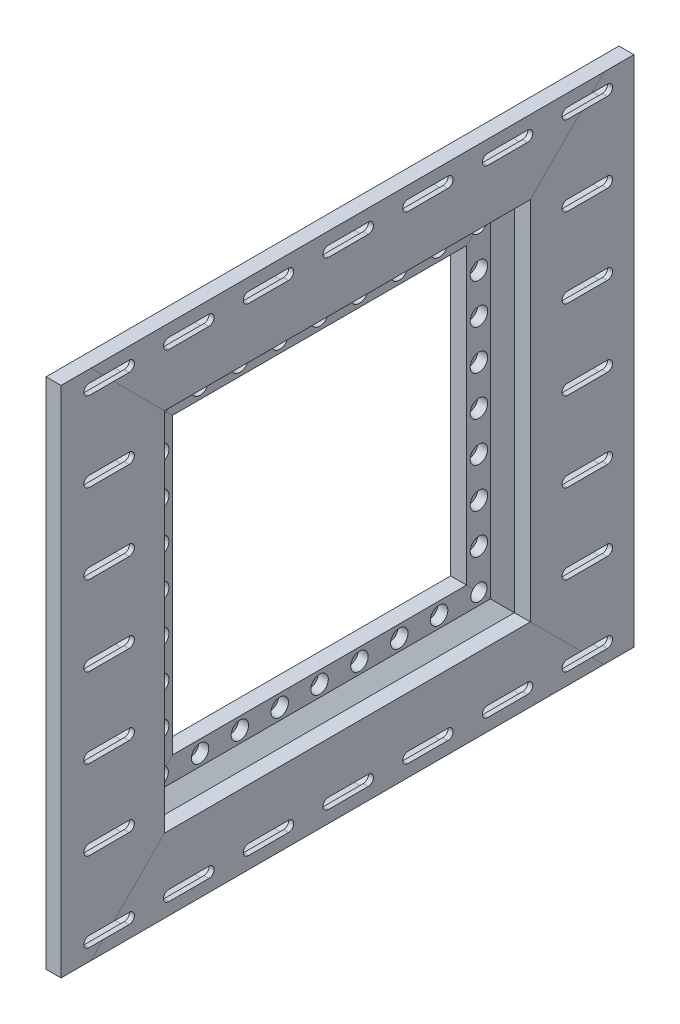
from build123d import *

# Parameters (mm, degrees)
FREE_START                                           = -9.2645
WALL_SCREW_HOLES_R                                   = 3.3782
WALL_SCREW_HOLES_R_2                                 = 5.1945
FREE_FIT_THROUGH_HOLES_DEPTH                         = 10.5345
WALL_SCREWS_CBORE_FOR_1_4_SOCKET_HEAD_CA_D           = 6.7564
WALL_SCREWS_CBORE_FOR_1_4_SOCKET_HEAD_CA_CBORE_D     = 11.1125
WALL_SCREWS_CBORE_FOR_1_4_SOCKET_HEAD_CA_CBORE_DEPTH = 6.35
BOSS_EXTRUDE1_START                                  = 9.525
SKETCH21_W                                           = 19.05
SKETCH21_H                                           = 327.15
BOSS_EXTRUDE1_DEPTH                                  = 9.525
CBORE_START                                          = 9.525
CBORE_SLOT_FOR_1_4_SOCKET_HEAD_CAP_SCREW_DEPTH       = 6.35
CBORE_START_2                                        = 15.875
CBORE_SLOT_FOR_1_4_SOCKET_HEAD_CAP_S_3_DEPTH         = 3.175


# Read off the part's stored shape, not the designer's step: CBORE SLOT for 1/4 Socket Head Cap Screw1
with BuildPart() as part:
    # Frame: sweep along a path in Boundary
    with BuildLine(Plane.ZY) as frame_path:
        Line((0, 0), (-263.65, 0))
        Line((-263.65, 0), (-263.65, 263.65))
        Line((-263.65, 263.65), (0, 263.65))
        Line((0, 263.65), (0, 0))
    # Leg Sketch → Frame (sweep)
    with BuildSketch(Plane.XY):
        Polygon((19.05, 15.24), (8.89, 15.24), (1.27, 22.86), (1.27, 38.1), (-8.89, 38.1), (-8.89, 25.4), (-15.24, 19.05), (-15.24, 15.24), (0, 0), (9.525, 0), (9.525, -31.75), (19.05, -31.75), align=None)
    sweep(path=frame_path.line, transition=Transition.RIGHT)

    # Wall Screw Holes → Free Fit Through Holes (cut)
    with BuildSketch(Plane(origin=(0, 0, 0), x_dir=(0, 0, -1), z_dir=(1, 0, 0)).offset(FREE_START)):
        with Locations(Location((30.23, 55.63, 0), (0, 0, 180))):
            Circle(WALL_SCREW_HOLES_R)
        with Locations(Location((55.63, 30.23, 0), (0, 0, 180))):
            Circle(WALL_SCREW_HOLES_R)
        with Locations(Location((30.23, 81.03, 0), (0, 0, 180))):
            Circle(WALL_SCREW_HOLES_R)
        with Locations(Location((30.23, 106.43, 0), (0, 0, 180))):
            Circle(WALL_SCREW_HOLES_R)
        with Locations(Location((30.23, 131.83, 0), (0, 0, 180))):
            Circle(WALL_SCREW_HOLES_R)
        with Locations(Location((30.23, 157.23, 0), (0, 0, 180))):
            Circle(WALL_SCREW_HOLES_R)
        with Locations(Location((30.23, 182.63, 0), (0, 0, 180))):
            Circle(WALL_SCREW_HOLES_R)
        with Locations(Location((30.23, 208.03, 0), (0, 0, 180))):
            Circle(WALL_SCREW_HOLES_R)
        with Locations(Location((55.63, 233.42, 0), (0, 0, 180))):
            Circle(WALL_SCREW_HOLES_R)
        with Locations(Location((81.03, 233.42, 0), (0, 0, 180))):
            Circle(WALL_SCREW_HOLES_R)
        with Locations(Location((81.03, 30.23, 0), (0, 0, 180))):
            Circle(WALL_SCREW_HOLES_R)
        with Locations(Location((106.43, 233.42, 0), (0, 0, 180))):
            Circle(WALL_SCREW_HOLES_R)
        with Locations(Location((106.43, 30.23, 0), (0, 0, 180))):
            Circle(WALL_SCREW_HOLES_R)
        with Locations(Location((131.83, 233.42, 0), (0, 0, 180))):
            Circle(WALL_SCREW_HOLES_R)
        with Locations(Location((131.83, 30.23, 0), (0, 0, 180))):
            Circle(WALL_SCREW_HOLES_R)
        with Locations(Location((157.23, 233.42, 0), (0, 0, 180))):
            Circle(WALL_SCREW_HOLES_R)
        with Locations(Location((157.23, 30.23, 0), (0, 0, 180))):
            Circle(WALL_SCREW_HOLES_R)
        with Locations(Location((182.63, 233.42, 0), (0, 0, 180))):
            Circle(WALL_SCREW_HOLES_R)
        with Locations(Location((182.63, 30.23, 0), (0, 0, 180))):
            Circle(WALL_SCREW_HOLES_R)
        with Locations(Location((208.03, 233.42, 0), (0, 0, 180))):
            Circle(WALL_SCREW_HOLES_R)
        with Locations(Location((208.03, 30.23, 0), (0, 0, 180))):
            Circle(WALL_SCREW_HOLES_R)
        with Locations(Location((233.42, 81.03, 0), (0, 0, 180))):
            Circle(WALL_SCREW_HOLES_R)
        with Locations(Location((233.42, 55.63, 0), (0, 0, 180))):
            Circle(WALL_SCREW_HOLES_R)
        with Locations(Location((233.42, 106.43, 0), (0, 0, 180))):
            Circle(WALL_SCREW_HOLES_R)
        with Locations(Location((233.42, 131.83, 0), (0, 0, 180))):
            Circle(WALL_SCREW_HOLES_R)
        with Locations(Location((233.42, 157.23, 0), (0, 0, 180))):
            Circle(WALL_SCREW_HOLES_R)
        with Locations(Location((233.42, 182.63, 0), (0, 0, 180))):
            Circle(WALL_SCREW_HOLES_R)
        with Locations(Location((233.42, 208.03, 0), (0, 0, 180))):
            Circle(WALL_SCREW_HOLES_R)
        with Locations(Location((30.23, 233.43, 0), (0, 0, 135.077994507))):
            Circle(WALL_SCREW_HOLES_R_2)
        with Locations(Location((233.42, 233.43, 0), (0, 0, 225.077994507))):
            Circle(WALL_SCREW_HOLES_R_2)
        with Locations(Location((233.42, 30.23, 0), (0, 0, 135))):
            Circle(WALL_SCREW_HOLES_R_2)
        with Locations(Location((30.23, 30.23, 0), (0, 0, 225))):
            Circle(WALL_SCREW_HOLES_R_2)
    extrude(amount=FREE_FIT_THROUGH_HOLES_DEPTH, mode=Mode.SUBTRACT)

    # Wall Screws CBORE for 1/4 Socket Head Cap Screw1 (through all)
    with Locations(Plane(origin=(1.27, 208.03, -30.23), x_dir=(0, 0, 1), z_dir=(1, 0, 0))):
        with Locations((0, 0), (0, 25.4), (0, 50.8), (0, 76.2), (0, 101.6), (0, 127), (0, 152.4), (-25.4, 177.8), (-50.8, 177.8), (-177.8, 177.8), (-152.4, 177.8), (-127, 177.8), (-101.6, 177.8), (-76.2, 177.8), (-203.19, 152.4), (-203.19, 127), (-203.19, 76.2), (-203.19, 50.8), (-203.19, 25.4), (-203.19, 0), (-177.8, -25.39), (-152.4, -25.39), (-127, -25.39), (-101.6, -25.39), (-76.2, -25.39), (-50.8, -25.39), (-25.4, -25.39), (-203.19, 101.6)):
            CounterBoreHole(WALL_SCREWS_CBORE_FOR_1_4_SOCKET_HEAD_CA_D / 2, WALL_SCREWS_CBORE_FOR_1_4_SOCKET_HEAD_CA_CBORE_D / 2, WALL_SCREWS_CBORE_FOR_1_4_SOCKET_HEAD_CA_CBORE_DEPTH)

    # Sketch21 → Boss-Extrude1 (add)
    with BuildSketch(Plane(origin=(0, 0, 0), x_dir=(0, 0, -1), z_dir=(1, 0, 0)).offset(BOSS_EXTRUDE1_START)):
        with Locations((304.925, 131.825)):
            Rectangle(SKETCH21_W, SKETCH21_H)
        with Locations((-41.275, 131.825)):
            Rectangle(SKETCH21_W, SKETCH21_H)
    extrude(amount=BOSS_EXTRUDE1_DEPTH)

    # CBORE SLOT for 1_4 Socket Head Cap S 2 → CBORE SLOT for 1/4 Socket Head Cap Screw1 (cut)
    with BuildSketch(Plane.YZ.offset(CBORE_START)):
        with BuildLine():
            ThreePointArc((238.98125, 32.8), (233.425, 38.35625), (227.86875, 32.8))
            Line((227.86875, 32.8), (227.86875, 7.4))
            ThreePointArc((227.86875, 7.4), (233.425, 1.84375), (238.98125, 7.4))
            Line((238.98125, 7.4), (238.98125, 32.8))
        make_face()
        with BuildLine():
            Line((238.98125, -297.4), (238.98125, -272))
            ThreePointArc((238.98125, -272), (233.425, -266.44375), (227.86875, -272))
            Line((227.86875, -272), (227.86875, -297.4))
            ThreePointArc((227.86875, -297.4), (233.425, -302.95625), (238.98125, -297.4))
        make_face()
        with BuildLine():
            ThreePointArc((188.18125, 32.8), (182.625, 38.35625), (177.06875, 32.8))
            Line((177.06875, 32.8), (177.06875, 7.4))
            ThreePointArc((177.06875, 7.4), (182.625, 1.84375), (188.18125, 7.4))
            Line((188.18125, 7.4), (188.18125, 32.8))
        make_face()
        with BuildLine():
            Line((188.18125, -297.4), (188.18125, -272))
            ThreePointArc((188.18125, -272), (182.625, -266.44375), (177.06875, -272))
            Line((177.06875, -272), (177.06875, -297.4))
            ThreePointArc((177.06875, -297.4), (182.625, -302.95625), (188.18125, -297.4))
        make_face()
        with BuildLine():
            ThreePointArc((137.38125, 32.8), (131.825, 38.35625), (126.26875, 32.8))
            Line((126.26875, 32.8), (126.26875, 7.4))
            ThreePointArc((126.26875, 7.4), (131.825, 1.84375), (137.38125, 7.4))
            Line((137.38125, 7.4), (137.38125, 32.8))
        make_face()
        with BuildLine():
            Line((137.38125, -297.4), (137.38125, -272))
            ThreePointArc((137.38125, -272), (131.825, -266.44375), (126.26875, -272))
            Line((126.26875, -272), (126.26875, -297.4))
            ThreePointArc((126.26875, -297.4), (131.825, -302.95625), (137.38125, -297.4))
        make_face()
        with BuildLine():
            ThreePointArc((86.58125, 32.8), (81.025, 38.35625), (75.46875, 32.8))
            Line((75.46875, 32.8), (75.46875, 7.4))
            ThreePointArc((75.46875, 7.4), (81.025, 1.84375), (86.58125, 7.4))
            Line((86.58125, 7.4), (86.58125, 32.8))
        make_face()
        with BuildLine():
            Line((86.58125, -297.4), (86.58125, -272))
            ThreePointArc((86.58125, -272), (81.025, -266.44375), (75.46875, -272))
            Line((75.46875, -272), (75.46875, -297.4))
            ThreePointArc((75.46875, -297.4), (81.025, -302.95625), (86.58125, -297.4))
        make_face()
        with BuildLine():
            ThreePointArc((35.78125, 32.8), (30.225, 38.35625), (24.66875, 32.8))
            Line((24.66875, 32.8), (24.66875, 7.4))
            ThreePointArc((24.66875, 7.4), (30.225, 1.84375), (35.78125, 7.4))
            Line((35.78125, 7.4), (35.78125, 32.8))
        make_face()
        with BuildLine():
            Line((35.78125, -297.4), (35.78125, -272))
            ThreePointArc((35.78125, -272), (30.225, -266.44375), (24.66875, -272))
            Line((24.66875, -272), (24.66875, -297.4))
            ThreePointArc((24.66875, -297.4), (30.225, -302.95625), (35.78125, -297.4))
        make_face()
        with BuildLine():
            ThreePointArc((-15.01875, 32.8), (-20.575, 38.35625), (-26.13125, 32.8))
            Line((-26.13125, 32.8), (-26.13125, 7.4))
            ThreePointArc((-26.13125, 7.4), (-20.575, 1.84375), (-15.01875, 7.4))
            Line((-15.01875, 7.4), (-15.01875, 32.8))
        make_face()
        with BuildLine():
            Line((-15.01875, -43.4), (-15.01875, -18))
            ThreePointArc((-15.01875, -18), (-20.575, -12.44375), (-26.13125, -18))
            Line((-26.13125, -18), (-26.13125, -43.4))
            ThreePointArc((-26.13125, -43.4), (-20.575, -48.95625), (-15.01875, -43.4))
        make_face()
        with BuildLine():
            Line((-15.01875, -94.2), (-15.01875, -68.8))
            ThreePointArc((-15.01875, -68.8), (-20.575, -63.24375), (-26.13125, -68.8))
            Line((-26.13125, -68.8), (-26.13125, -94.2))
            ThreePointArc((-26.13125, -94.2), (-20.575, -99.75625), (-15.01875, -94.2))
        make_face()
        with BuildLine():
            Line((-15.01875, -145), (-15.01875, -119.6))
            ThreePointArc((-15.01875, -119.6), (-20.575, -114.04375), (-26.13125, -119.6))
            Line((-26.13125, -119.6), (-26.13125, -145))
            ThreePointArc((-26.13125, -145), (-20.575, -150.55625), (-15.01875, -145))
        make_face()
        with BuildLine():
            Line((-15.01875, -195.8), (-15.01875, -170.4))
            ThreePointArc((-15.01875, -170.4), (-20.575, -164.84375), (-26.13125, -170.4))
            Line((-26.13125, -170.4), (-26.13125, -195.8))
            ThreePointArc((-26.13125, -195.8), (-20.575, -201.35625), (-15.01875, -195.8))
        make_face()
        with BuildLine():
            Line((-15.01875, -246.6), (-15.01875, -221.2))
            ThreePointArc((-15.01875, -221.2), (-20.575, -215.64375), (-26.13125, -221.2))
            Line((-26.13125, -221.2), (-26.13125, -246.6))
            ThreePointArc((-26.13125, -246.6), (-20.575, -252.15625), (-15.01875, -246.6))
        make_face()
        with BuildLine():
            Line((-15.01875, -297.4), (-15.01875, -272))
            ThreePointArc((-15.01875, -272), (-20.575, -266.44375), (-26.13125, -272))
            Line((-26.13125, -272), (-26.13125, -297.4))
            ThreePointArc((-26.13125, -297.4), (-20.575, -302.95625), (-15.01875, -297.4))
        make_face()
        with BuildLine():
            ThreePointArc((289.78125, -272), (284.225, -266.44375), (278.66875, -272))
            Line((278.66875, -272), (278.66875, -297.4))
            ThreePointArc((278.66875, -297.4), (284.225, -302.95625), (289.78125, -297.4))
            Line((289.78125, -297.4), (289.78125, -272))
        make_face()
        with BuildLine():
            Line((289.78125, -246.6), (289.78125, -221.2))
            ThreePointArc((289.78125, -221.2), (284.225, -215.64375), (278.66875, -221.2))
            Line((278.66875, -221.2), (278.66875, -246.6))
            ThreePointArc((278.66875, -246.6), (284.225, -252.15625), (289.78125, -246.6))
        make_face()
        with BuildLine():
            Line((289.78125, -195.8), (289.78125, -170.4))
            ThreePointArc((289.78125, -170.4), (284.225, -164.84375), (278.66875, -170.4))
            Line((278.66875, -170.4), (278.66875, -195.8))
            ThreePointArc((278.66875, -195.8), (284.225, -201.35625), (289.78125, -195.8))
        make_face()
        with BuildLine():
            Line((289.78125, -145), (289.78125, -119.6))
            ThreePointArc((289.78125, -119.6), (284.225, -114.04375), (278.66875, -119.6))
            Line((278.66875, -119.6), (278.66875, -145))
            ThreePointArc((278.66875, -145), (284.225, -150.55625), (289.78125, -145))
        make_face()
        with BuildLine():
            Line((289.78125, -94.2), (289.78125, -68.8))
            ThreePointArc((289.78125, -68.8), (284.225, -63.24375), (278.66875, -68.8))
            Line((278.66875, -68.8), (278.66875, -94.2))
            ThreePointArc((278.66875, -94.2), (284.225, -99.75625), (289.78125, -94.2))
        make_face()
        with BuildLine():
            Line((289.78125, -43.4), (289.78125, -18))
            ThreePointArc((289.78125, -18), (284.225, -12.44375), (278.66875, -18))
            Line((278.66875, -18), (278.66875, -43.4))
            ThreePointArc((278.66875, -43.4), (284.225, -48.95625), (289.78125, -43.4))
        make_face()
        with BuildLine():
            Line((289.78125, 7.4), (289.78125, 32.8))
            ThreePointArc((289.78125, 32.8), (284.225, 38.35625), (278.66875, 32.8))
            Line((278.66875, 32.8), (278.66875, 7.4))
            ThreePointArc((278.66875, 7.4), (284.225, 1.84375), (289.78125, 7.4))
        make_face()
    extrude(amount=CBORE_SLOT_FOR_1_4_SOCKET_HEAD_CAP_SCREW_DEPTH, mode=Mode.SUBTRACT)

    # CBORE SLOT for 1_4 Socket Head Cap S 3 o → CBORE SLOT for 1_4 Socket Head Cap S 3 (cut)
    with BuildSketch(Plane.YZ.offset(CBORE_START_2)):
        with BuildLine():
            ThreePointArc((236.8032, 32.8), (233.425, 36.1782), (230.0468, 32.8))
            Line((230.0468, 32.8), (230.0468, 7.4))
            ThreePointArc((230.0468, 7.4), (233.425, 4.0218), (236.8032, 7.4))
            Line((236.8032, 7.4), (236.8032, 32.8))
        make_face()
        with BuildLine():
            Line((236.8032, -297.4), (236.8032, -272))
            ThreePointArc((236.8032, -272), (233.425, -268.6218), (230.0468, -272))
            Line((230.0468, -272), (230.0468, -297.4))
            ThreePointArc((230.0468, -297.4), (233.425, -300.7782), (236.8032, -297.4))
        make_face()
        with BuildLine():
            ThreePointArc((186.0032, 32.8), (182.625, 36.1782), (179.2468, 32.8))
            Line((179.2468, 32.8), (179.2468, 7.4))
            ThreePointArc((179.2468, 7.4), (182.625, 4.0218), (186.0032, 7.4))
            Line((186.0032, 7.4), (186.0032, 32.8))
        make_face()
        with BuildLine():
            Line((186.0032, -297.4), (186.0032, -272))
            ThreePointArc((186.0032, -272), (182.625, -268.6218), (179.2468, -272))
            Line((179.2468, -272), (179.2468, -297.4))
            ThreePointArc((179.2468, -297.4), (182.625, -300.7782), (186.0032, -297.4))
        make_face()
        with BuildLine():
            ThreePointArc((135.2032, 32.8), (131.825, 36.1782), (128.4468, 32.8))
            Line((128.4468, 32.8), (128.4468, 7.4))
            ThreePointArc((128.4468, 7.4), (131.825, 4.0218), (135.2032, 7.4))
            Line((135.2032, 7.4), (135.2032, 32.8))
        make_face()
        with BuildLine():
            Line((135.2032, -297.4), (135.2032, -272))
            ThreePointArc((135.2032, -272), (131.825, -268.6218), (128.4468, -272))
            Line((128.4468, -272), (128.4468, -297.4))
            ThreePointArc((128.4468, -297.4), (131.825, -300.7782), (135.2032, -297.4))
        make_face()
        with BuildLine():
            ThreePointArc((84.4032, 32.8), (81.025, 36.1782), (77.6468, 32.8))
            Line((77.6468, 32.8), (77.6468, 7.4))
            ThreePointArc((77.6468, 7.4), (81.025, 4.0218), (84.4032, 7.4))
            Line((84.4032, 7.4), (84.4032, 32.8))
        make_face()
        with BuildLine():
            Line((84.4032, -297.4), (84.4032, -272))
            ThreePointArc((84.4032, -272), (81.025, -268.6218), (77.6468, -272))
            Line((77.6468, -272), (77.6468, -297.4))
            ThreePointArc((77.6468, -297.4), (81.025, -300.7782), (84.4032, -297.4))
        make_face()
        with BuildLine():
            ThreePointArc((33.6032, 32.8), (30.225, 36.1782), (26.8468, 32.8))
            Line((26.8468, 32.8), (26.8468, 7.4))
            ThreePointArc((26.8468, 7.4), (30.225, 4.0218), (33.6032, 7.4))
            Line((33.6032, 7.4), (33.6032, 32.8))
        make_face()
        with BuildLine():
            Line((33.6032, -297.4), (33.6032, -272))
            ThreePointArc((33.6032, -272), (30.225, -268.6218), (26.8468, -272))
            Line((26.8468, -272), (26.8468, -297.4))
            ThreePointArc((26.8468, -297.4), (30.225, -300.7782), (33.6032, -297.4))
        make_face()
        with BuildLine():
            ThreePointArc((-17.1968, 32.8), (-20.575, 36.1782), (-23.9532, 32.8))
            Line((-23.9532, 32.8), (-23.9532, 7.4))
            ThreePointArc((-23.9532, 7.4), (-20.575, 4.0218), (-17.1968, 7.4))
            Line((-17.1968, 7.4), (-17.1968, 32.8))
        make_face()
        with BuildLine():
            Line((-17.1968, -43.4), (-17.1968, -18))
            ThreePointArc((-17.1968, -18), (-20.575, -14.6218), (-23.9532, -18))
            Line((-23.9532, -18), (-23.9532, -43.4))
            ThreePointArc((-23.9532, -43.4), (-20.575, -46.7782), (-17.1968, -43.4))
        make_face()
        with BuildLine():
            Line((-17.1968, -94.2), (-17.1968, -68.8))
            ThreePointArc((-17.1968, -68.8), (-20.575, -65.4218), (-23.9532, -68.8))
            Line((-23.9532, -68.8), (-23.9532, -94.2))
            ThreePointArc((-23.9532, -94.2), (-20.575, -97.5782), (-17.1968, -94.2))
        make_face()
        with BuildLine():
            Line((-17.1968, -145), (-17.1968, -119.6))
            ThreePointArc((-17.1968, -119.6), (-20.575, -116.2218), (-23.9532, -119.6))
            Line((-23.9532, -119.6), (-23.9532, -145))
            ThreePointArc((-23.9532, -145), (-20.575, -148.3782), (-17.1968, -145))
        make_face()
        with BuildLine():
            Line((-17.1968, -195.8), (-17.1968, -170.4))
            ThreePointArc((-17.1968, -170.4), (-20.575, -167.0218), (-23.9532, -170.4))
            Line((-23.9532, -170.4), (-23.9532, -195.8))
            ThreePointArc((-23.9532, -195.8), (-20.575, -199.1782), (-17.1968, -195.8))
        make_face()
        with BuildLine():
            Line((-17.1968, -246.6), (-17.1968, -221.2))
            ThreePointArc((-17.1968, -221.2), (-20.575, -217.8218), (-23.9532, -221.2))
            Line((-23.9532, -221.2), (-23.9532, -246.6))
            ThreePointArc((-23.9532, -246.6), (-20.575, -249.9782), (-17.1968, -246.6))
        make_face()
        with BuildLine():
            Line((-17.1968, -297.4), (-17.1968, -272))
            ThreePointArc((-17.1968, -272), (-20.575, -268.6218), (-23.9532, -272))
            Line((-23.9532, -272), (-23.9532, -297.4))
            ThreePointArc((-23.9532, -297.4), (-20.575, -300.7782), (-17.1968, -297.4))
        make_face()
        with BuildLine():
            ThreePointArc((287.6032, -272), (284.225, -268.6218), (280.8468, -272))
            Line((280.8468, -272), (280.8468, -297.4))
            ThreePointArc((280.8468, -297.4), (284.225, -300.7782), (287.6032, -297.4))
            Line((287.6032, -297.4), (287.6032, -272))
        make_face()
        with BuildLine():
            Line((287.6032, -246.6), (287.6032, -221.2))
            ThreePointArc((287.6032, -221.2), (284.225, -217.8218), (280.8468, -221.2))
            Line((280.8468, -221.2), (280.8468, -246.6))
            ThreePointArc((280.8468, -246.6), (284.225, -249.9782), (287.6032, -246.6))
        make_face()
        with BuildLine():
            Line((287.6032, -195.8), (287.6032, -170.4))
            ThreePointArc((287.6032, -170.4), (284.225, -167.0218), (280.8468, -170.4))
            Line((280.8468, -170.4), (280.8468, -195.8))
            ThreePointArc((280.8468, -195.8), (284.225, -199.1782), (287.6032, -195.8))
        make_face()
        with BuildLine():
            Line((287.6032, -145), (287.6032, -119.6))
            ThreePointArc((287.6032, -119.6), (284.225, -116.2218), (280.8468, -119.6))
            Line((280.8468, -119.6), (280.8468, -145))
            ThreePointArc((280.8468, -145), (284.225, -148.3782), (287.6032, -145))
        make_face()
        with BuildLine():
            Line((287.6032, -94.2), (287.6032, -68.8))
            ThreePointArc((287.6032, -68.8), (284.225, -65.4218), (280.8468, -68.8))
            Line((280.8468, -68.8), (280.8468, -94.2))
            ThreePointArc((280.8468, -94.2), (284.225, -97.5782), (287.6032, -94.2))
        make_face()
        with BuildLine():
            Line((287.6032, -43.4), (287.6032, -18))
            ThreePointArc((287.6032, -18), (284.225, -14.6218), (280.8468, -18))
            Line((280.8468, -18), (280.8468, -43.4))
            ThreePointArc((280.8468, -43.4), (284.225, -46.7782), (287.6032, -43.4))
        make_face()
        with BuildLine():
            Line((287.6032, 7.4), (287.6032, 32.8))
            ThreePointArc((287.6032, 32.8), (284.225, 36.1782), (280.8468, 32.8))
            Line((280.8468, 32.8), (280.8468, 7.4))
            ThreePointArc((280.8468, 7.4), (284.225, 4.0218), (287.6032, 7.4))
        make_face()
    extrude(amount=CBORE_SLOT_FOR_1_4_SOCKET_HEAD_CAP_S_3_DEPTH, mode=Mode.SUBTRACT)


solid = part.part
